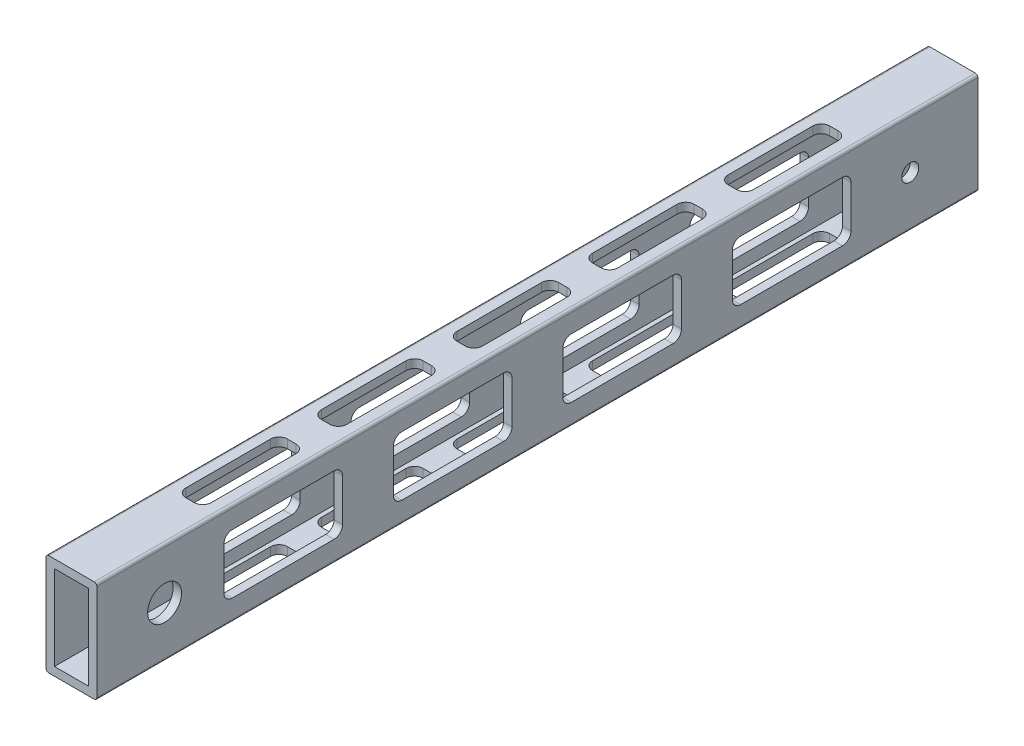
from build123d import *

# Parameters (mm, degrees)
SKETCH1_W               = 12.7
SKETCH1_H               = 31.75
BOSS_EXTRUDE1_DEPTH     = 165.1
CUT_EXTRUDE1_DEPTH      = 170.706645789
CUT_EXTRUDE1_DEPTH_BACK = 170.706645789
CUT_EXTRUDE2_DEPTH      = 168.283636378
CUT_EXTRUDE2_DEPTH_BACK = 168.283636378
CUT_EXTRUDE3_DEPTH      = 168.283636378
CUT_EXTRUDE3_DEPTH_BACK = 168.283636378
SKETCH4_R               = 6.35
SKETCH4_R_2             = 3.175


with BuildPart() as part:
    # Sketch1 → Boss-Extrude1 (new, symmetric)
    with BuildSketch(Plane.XY):
        with BuildLine():
            Line((-8.525, -19.05), (8.525, -19.05))
            ThreePointArc((8.525, -19.05), (9.232106781, -18.757106781), (9.525, -18.05))
            Line((9.525, -18.05), (9.525, 18.05))
            ThreePointArc((9.525, 18.05), (9.232106781, 18.757106781), (8.525, 19.05))
            Line((8.525, 19.05), (-8.525, 19.05))
            ThreePointArc((-8.525, 19.05), (-9.232106781, 18.757106781), (-9.525, 18.05))
            Line((-9.525, 18.05), (-9.525, -18.05))
            ThreePointArc((-9.525, -18.05), (-9.232106781, -18.757106781), (-8.525, -19.05))
        make_face()
        Rectangle(SKETCH1_W, SKETCH1_H, mode=Mode.SUBTRACT)
    extrude(amount=BOSS_EXTRUDE1_DEPTH, both=True)

    # Sketch2 → Cut-Extrude1 (cut, two sides: drawn at the far end of the back side and taken through both)
    with BuildSketch(Plane(origin=(0, 19.05, 0), x_dir=(1, 0, 0), z_dir=(0, 1, 0)).offset(-CUT_EXTRUDE1_DEPTH_BACK)):
        with BuildLine():
            Line((-4.7625, -66.675), (-4.7625, -34.925))
            ThreePointArc((-4.7625, -34.925), (-3.83256403, -32.67993597), (-1.5875, -31.75))
            Line((-1.5875, -31.75), (1.5875, -31.75))
            ThreePointArc((1.5875, -31.75), (3.83256403, -32.67993597), (4.7625, -34.925))
            Line((4.7625, -34.925), (4.7625, -66.675))
            ThreePointArc((4.7625, -66.675), (3.83256403, -68.92006403), (1.5875, -69.85))
            Line((1.5875, -69.85), (-1.5875, -69.85))
            ThreePointArc((-1.5875, -69.85), (-3.83256403, -68.92006403), (-4.7625, -66.675))
        make_face()
        with BuildLine():
            Line((-1.5875, -120.65), (1.5875, -120.65))
            ThreePointArc((1.5875, -120.65), (3.83256403, -119.72006403), (4.7625, -117.475))
            Line((4.7625, -117.475), (4.7625, -85.725))
            ThreePointArc((4.7625, -85.725), (3.83256403, -83.47993597), (1.5875, -82.55))
            Line((1.5875, -82.55), (-1.5875, -82.55))
            ThreePointArc((-1.5875, -82.55), (-3.83256403, -83.47993597), (-4.7625, -85.725))
            Line((-4.7625, -85.725), (-4.7625, -117.475))
            ThreePointArc((-4.7625, -117.475), (-3.83256403, -119.72006403), (-1.5875, -120.65))
        make_face()
        with BuildLine():
            Line((-4.7625, -15.875), (-4.7625, 15.875))
            ThreePointArc((-4.7625, 15.875), (-3.83256403, 18.12006403), (-1.5875, 19.05))
            Line((-1.5875, 19.05), (1.5875, 19.05))
            ThreePointArc((1.5875, 19.05), (3.83256403, 18.12006403), (4.7625, 15.875))
            Line((4.7625, 15.875), (4.7625, -15.875))
            ThreePointArc((4.7625, -15.875), (3.83256403, -18.12006403), (1.5875, -19.05))
            Line((1.5875, -19.05), (-1.5875, -19.05))
            ThreePointArc((-1.5875, -19.05), (-3.83256403, -18.12006403), (-4.7625, -15.875))
        make_face()
        with BuildLine():
            Line((-4.7625, 34.925), (-4.7625, 66.675))
            ThreePointArc((-4.7625, 66.675), (-3.83256403, 68.92006403), (-1.5875, 69.85))
            Line((-1.5875, 69.85), (1.5875, 69.85))
            ThreePointArc((1.5875, 69.85), (3.83256403, 68.92006403), (4.7625, 66.675))
            Line((4.7625, 66.675), (4.7625, 34.925))
            ThreePointArc((4.7625, 34.925), (3.83256403, 32.67993597), (1.5875, 31.75))
            Line((1.5875, 31.75), (-1.5875, 31.75))
            ThreePointArc((-1.5875, 31.75), (-3.83256403, 32.67993597), (-4.7625, 34.925))
        make_face()
        with BuildLine():
            Line((-4.7625, 85.725), (-4.7625, 117.475))
            ThreePointArc((-4.7625, 117.475), (-3.83256403, 119.72006403), (-1.5875, 120.65))
            Line((-1.5875, 120.65), (1.5875, 120.65))
            ThreePointArc((1.5875, 120.65), (3.83256403, 119.72006403), (4.7625, 117.475))
            Line((4.7625, 117.475), (4.7625, 85.725))
            ThreePointArc((4.7625, 85.725), (3.83256403, 83.47993597), (1.5875, 82.55))
            Line((1.5875, 82.55), (-1.5875, 82.55))
            ThreePointArc((-1.5875, 82.55), (-3.83256403, 83.47993597), (-4.7625, 85.725))
        make_face()
    extrude(amount=CUT_EXTRUDE1_DEPTH + CUT_EXTRUDE1_DEPTH_BACK, mode=Mode.SUBTRACT)

    # Sketch3 → Cut-Extrude2 (cut, two sides: drawn at the far end of the back side and taken through both)
    with BuildSketch(Plane(origin=(9.525, 0, 0), x_dir=(0, 0, -1), z_dir=(1, 0, 0)).offset(-CUT_EXTRUDE2_DEPTH_BACK)):
        with BuildLine():
            Line((-53.975, -7.9375), (-53.975, 7.9375))
            ThreePointArc((-53.975, 7.9375), (-53.04506403, 10.18256403), (-50.8, 11.1125))
            Line((-50.8, 11.1125), (-12.7, 11.1125))
            ThreePointArc((-12.7, 11.1125), (-10.45493597, 10.18256403), (-9.525, 7.9375))
            Line((-9.525, 7.9375), (-9.525, -7.9375))
            ThreePointArc((-9.525, -7.9375), (-10.45493597, -10.18256403), (-12.7, -11.1125))
            Line((-12.7, -11.1125), (-50.8, -11.1125))
            ThreePointArc((-50.8, -11.1125), (-53.04506403, -10.18256403), (-53.975, -7.9375))
        make_face()
        with BuildLine():
            Line((-114.3, -11.1125), (-76.2, -11.1125))
            ThreePointArc((-76.2, -11.1125), (-73.95493597, -10.18256403), (-73.025, -7.9375))
            Line((-73.025, -7.9375), (-73.025, 7.9375))
            ThreePointArc((-73.025, 7.9375), (-73.95493597, 10.18256403), (-76.2, 11.1125))
            Line((-76.2, 11.1125), (-114.3, 11.1125))
            ThreePointArc((-114.3, 11.1125), (-116.54506403, 10.18256403), (-117.475, 7.9375))
            Line((-117.475, 7.9375), (-117.475, -7.9375))
            ThreePointArc((-117.475, -7.9375), (-116.54506403, -10.18256403), (-114.3, -11.1125))
        make_face()
        with BuildLine():
            Line((9.525, -7.9375), (9.525, 7.9375))
            ThreePointArc((9.525, 7.9375), (10.45493597, 10.18256403), (12.7, 11.1125))
            Line((12.7, 11.1125), (50.8, 11.1125))
            ThreePointArc((50.8, 11.1125), (53.04506403, 10.18256403), (53.975, 7.9375))
            Line((53.975, 7.9375), (53.975, -7.9375))
            ThreePointArc((53.975, -7.9375), (53.04506403, -10.18256403), (50.8, -11.1125))
            Line((50.8, -11.1125), (12.7, -11.1125))
            ThreePointArc((12.7, -11.1125), (10.45493597, -10.18256403), (9.525, -7.9375))
        make_face()
        with BuildLine():
            Line((73.025, -7.9375), (73.025, 7.9375))
            ThreePointArc((73.025, 7.9375), (73.95493597, 10.18256403), (76.2, 11.1125))
            Line((76.2, 11.1125), (114.3, 11.1125))
            ThreePointArc((114.3, 11.1125), (116.54506403, 10.18256403), (117.475, 7.9375))
            Line((117.475, 7.9375), (117.475, -7.9375))
            ThreePointArc((117.475, -7.9375), (116.54506403, -10.18256403), (114.3, -11.1125))
            Line((114.3, -11.1125), (76.2, -11.1125))
            ThreePointArc((76.2, -11.1125), (73.95493597, -10.18256403), (73.025, -7.9375))
        make_face()
    extrude(amount=CUT_EXTRUDE2_DEPTH + CUT_EXTRUDE2_DEPTH_BACK, mode=Mode.SUBTRACT)

    # Sketch4 → Cut-Extrude3 (cut, two sides: drawn at the far end of the back side and taken through both)
    with BuildSketch(Plane(origin=(9.525, 0, 0), x_dir=(0, 0, -1), z_dir=(1, 0, 0)).offset(-CUT_EXTRUDE3_DEPTH_BACK)):
        with Locations((-139.7, 0)):
            Circle(SKETCH4_R)
        with Locations((139.7, 0)):
            Circle(SKETCH4_R_2)
    extrude(amount=CUT_EXTRUDE3_DEPTH + CUT_EXTRUDE3_DEPTH_BACK, mode=Mode.SUBTRACT)


solid = part.part
